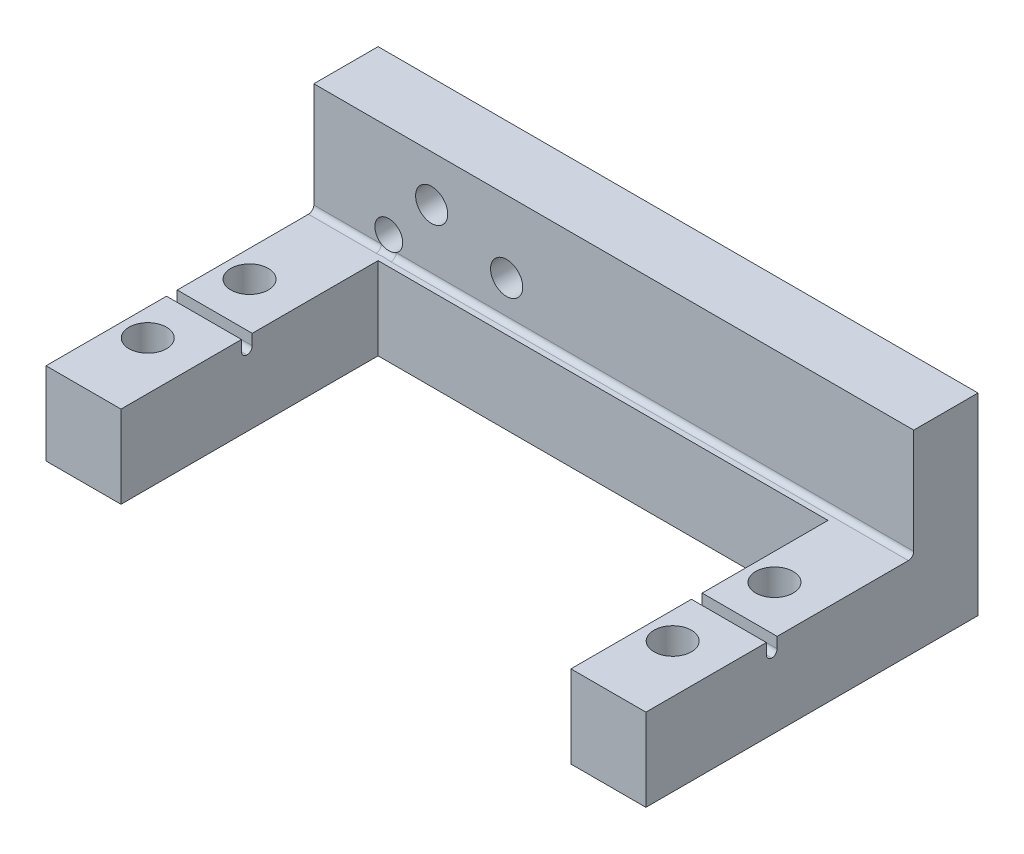
from build123d import *

# Parameters (mm, degrees)
SKETCH_1_W           = 58
SKETCH_1_H           = 13
EXTRUDE_1_DEPTH      = 6
SKETCH_9_W           = 58
SKETCH_9_H           = 2.7
EXTRUDE_5_DEPTH      = 22
SKETCH_10_R          = 1.75
CUT_EXTRUDE_6_DEPTH  = 42.606369705
SKETCH_11_W          = 40
SKETCH_11_H          = 20
CUT_EXTRUDE_7_DEPTH  = 42.606369705
SKETCH_13_W          = 2
SKETCH_13_H          = 13
CUT_EXTRUDE_8_DEPTH  = 41.831972766
SKETCH_3_R           = 1.3
SKETCH_3_R_2         = 1.5
CUT_EXTRUDE_9_DEPTH  = 10
SKETCH_14_W          = 40
SKETCH_14_H          = 20
EXTRUDE_6_DEPTH      = 5
SKETCH_15_R          = 1.75
CUT_EXTRUDE_10_DEPTH = 42.606369705
SKETCH_16_W          = 40
SKETCH_16_H          = 1
CUT_EXTRUDE_11_DEPTH = 10
SKETCH_17_W          = 2
SKETCH_17_H          = 21
CUT_EXTRUDE_13_DEPTH = 10
SKETCH_18_W          = 7
SKETCH_18_H          = 1
CUT_EXTRUDE_14_DEPTH = 1.5
FILLET_1_R           = 0.5
SKETCH_21_R          = 1.5
CUT_EXTRUDE_16_DEPTH = 10
FILLET_4_R           = 0.5
SKETCH_23_W          = 7
SKETCH_23_H          = 7.7
EXTRUDE_7_DEPTH      = 3


with BuildPart() as part:
    # 草图1 → 凸台-拉伸1 (new body)
    with BuildSketch(Plane.XY):
        Rectangle(SKETCH_1_W, SKETCH_1_H)
    extrude(amount=EXTRUDE_1_DEPTH)

    # 草图9 → 凸台-拉伸5 (add)
    with BuildSketch(Plane.XY.offset(6)):
        with Locations((0, -5.15)):
            Rectangle(SKETCH_9_W, SKETCH_9_H)
    extrude(amount=EXTRUDE_5_DEPTH)

    # 草图10 → 切除-拉伸6 (cut, through all)
    with BuildSketch(Plane(origin=(0, -3.8, 0), x_dir=(1, 0, 0), z_dir=(0, 1, 0))):
        with Locations(Location((-24.5, -24, 0), (0, 0, 270))):
            Circle(SKETCH_10_R)
        with Locations(Location((-24.5, -14.5, 0), (0, 0, 270))):
            Circle(SKETCH_10_R)
        with Locations(Location((24.5, -24, 0), (0, 0, 270))):
            Circle(SKETCH_10_R)
        with Locations(Location((24.5, -14.5, 0), (0, 0, 270))):
            Circle(SKETCH_10_R)
    extrude(amount=-CUT_EXTRUDE_6_DEPTH, mode=Mode.SUBTRACT)

    # 草图11 → 切除-拉伸7 (cut, through all)
    with BuildSketch(Plane(origin=(0, -3.8, 0), x_dir=(1, 0, 0), z_dir=(0, 1, 0))):
        with Locations((0, -17)):
            Rectangle(SKETCH_11_W, SKETCH_11_H)
    extrude(amount=-CUT_EXTRUDE_7_DEPTH, mode=Mode.SUBTRACT)

    # 草图13 → 切除-拉伸8 (cut, through all)
    with BuildSketch(Plane.XY.offset(28)):
        with Locations((-28, 0)):
            Rectangle(SKETCH_13_W, SKETCH_13_H)
    extrude(amount=-CUT_EXTRUDE_8_DEPTH, mode=Mode.SUBTRACT)

    # 草图3 → 切除-拉伸9 (cut)
    with BuildSketch(Plane(origin=(0, 0, 0), x_dir=(-1, 0, 0), z_dir=(0, 0, -1))):
        with Locations((20, -2.2)):
            Circle(SKETCH_3_R)
        with Locations((9, -0.2)):
            Circle(SKETCH_3_R_2)
    extrude(amount=-CUT_EXTRUDE_9_DEPTH, mode=Mode.SUBTRACT)

    # 草图14 → 凸台-拉伸6 (add)
    with BuildSketch(Plane.XZ.offset(6.5)):
        Polygon((-27, 28), (-20, 28), (20, 28), (29, 28), (29, 0), (-20, 0), (-27, 0), align=None)
        with Locations((0, 17)):
            Rectangle(SKETCH_14_W, SKETCH_14_H, mode=Mode.SUBTRACT)
    extrude(amount=EXTRUDE_6_DEPTH)

    # 草图15 → 切除-拉伸10 (cut, through all)
    with BuildSketch(Plane(origin=(0, -3.8, 0), x_dir=(1, 0, 0), z_dir=(0, 1, 0))):
        with Locations(Location((-24.5, -14.5, 0), (0, 0, 270))):
            Circle(SKETCH_15_R)
        with Locations(Location((-24.5, -24, 0), (0, 0, 270))):
            Circle(SKETCH_15_R)
        with Locations(Location((24.5, -14.5, 0), (0, 0, 270))):
            Circle(SKETCH_15_R)
        with Locations(Location((24.5, -24, 0), (0, 0, 270))):
            Circle(SKETCH_15_R)
    extrude(amount=-CUT_EXTRUDE_10_DEPTH, mode=Mode.SUBTRACT)

    # 草图16 → 切除-拉伸11 (cut)
    with BuildSketch(Plane(origin=(0, -3.8, 0), x_dir=(1, 0, 0), z_dir=(0, 1, 0))):
        with Locations((0, -27.5)):
            Rectangle(SKETCH_16_W, SKETCH_16_H)
    extrude(amount=-CUT_EXTRUDE_11_DEPTH, mode=Mode.SUBTRACT)

    # 草图17 → 切除-拉伸13 (cut)
    with BuildSketch(Plane(origin=(0, -3.8, 0), x_dir=(1, 0, 0), z_dir=(0, 1, 0))):
        with Locations((21, -17.5)):
            Rectangle(SKETCH_17_W, SKETCH_17_H)
    extrude(amount=-CUT_EXTRUDE_13_DEPTH, mode=Mode.SUBTRACT)

    # 草图18 → 切除-拉伸14 (cut)
    with BuildSketch(Plane(origin=(0, -3.8, 0), x_dir=(1, 0, 0), z_dir=(0, 1, 0))):
        with Locations((-23.5, -19.25)):
            Rectangle(SKETCH_18_W, SKETCH_18_H)
        with Locations((25.5, -19.25)):
            Rectangle(SKETCH_18_W, SKETCH_18_H)
    extrude(amount=-CUT_EXTRUDE_14_DEPTH, mode=Mode.SUBTRACT)

    # 圆角1
    fillet_1_edges = [part.edges().sort_by_distance(p)[0] for p in [
        (1, -3.8, 6),
    ]]
    fillet(fillet_1_edges, radius=FILLET_1_R)

    # 草图21 → 切除-拉伸16 (cut)
    with BuildSketch(Plane.XY.offset(6)):
        with Locations((-16, 2.2)):
            Circle(SKETCH_21_R)
    extrude(amount=-CUT_EXTRUDE_16_DEPTH, mode=Mode.SUBTRACT)

    # 圆角4
    fillet_4_edges = [part.edges().sort_by_distance(p)[0] for p in [
        (25.5, -5.3, 19.75),
        (25.5, -5.3, 18.75),
        (-23.5, -5.3, 19.75),
        (-23.5, -5.3, 18.75),
    ]]
    fillet(fillet_4_edges, radius=FILLET_4_R - 0.0001)  # a hair under: the kernel refuses the full size

    # 草图23 → 凸台-拉伸7 (add)
    with BuildSketch(Plane.XY.offset(28)):
        with Locations((-23.5, -7.65)):
            Rectangle(SKETCH_23_W, SKETCH_23_H)
        with Locations((25.5, -7.65)):
            Rectangle(SKETCH_23_W, SKETCH_23_H)
    extrude(amount=EXTRUDE_7_DEPTH)


solid = part.part
